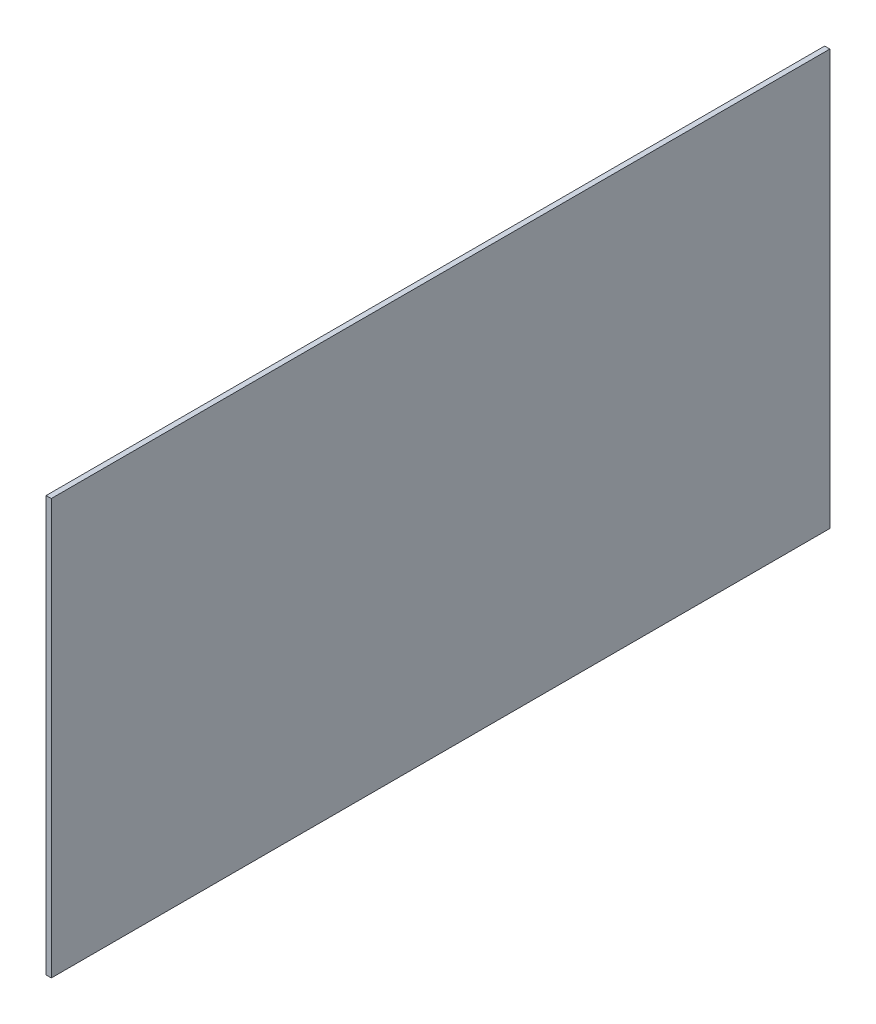
from build123d import *

# Parameters (mm, degrees)
SKETCH1_W           = 450
SKETCH1_H           = 240
BOSS_EXTRUDE1_DEPTH = 1.5


with BuildPart() as part:
    # Sketch1 → Boss-Extrude1 (new, symmetric)
    with BuildSketch(Plane(origin=(0, 0, 0), x_dir=(0, 0, -1), z_dir=(1, 0, 0))):
        Rectangle(SKETCH1_W, SKETCH1_H)
    extrude(amount=BOSS_EXTRUDE1_DEPTH, both=True)


solid = part.part
